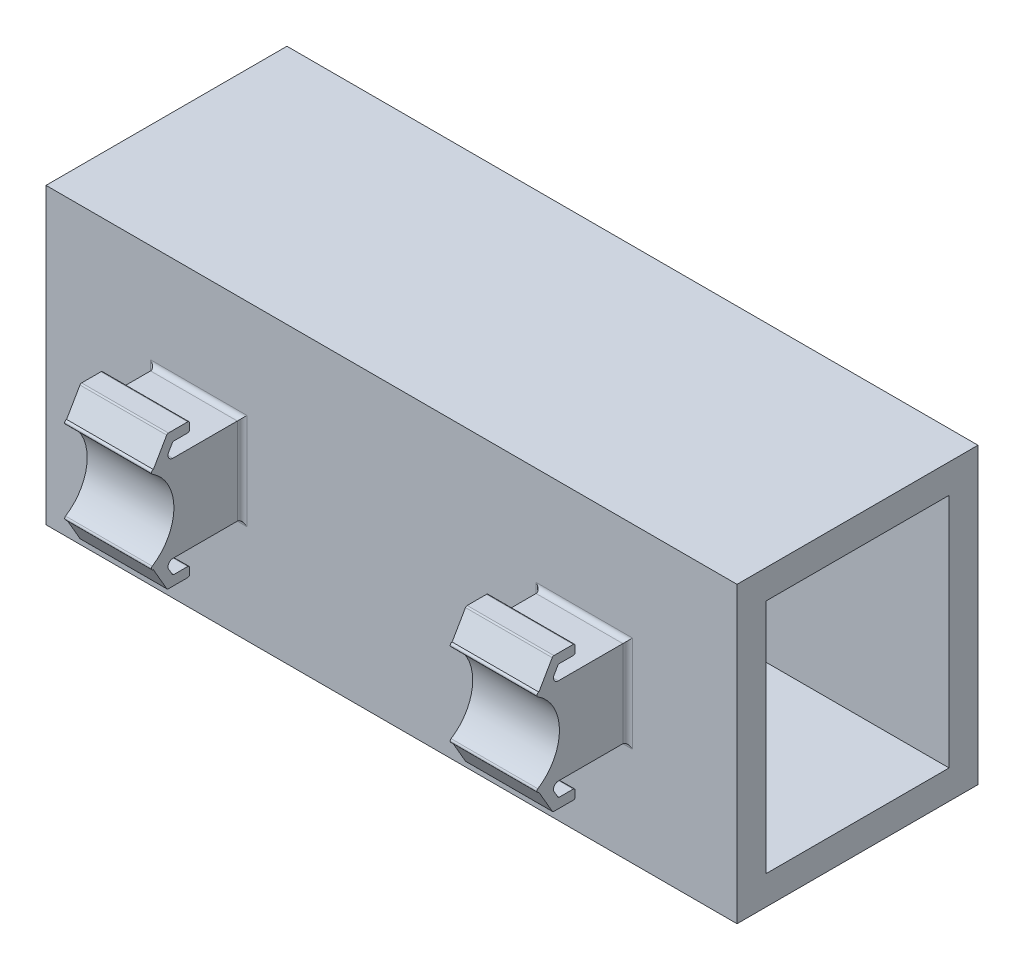
from build123d import *

# Parameters (mm, degrees)
SKETCH_1_W          = 71.7
SKETCH_1_H          = 30.5
EXTRUDE_1_DEPTH     = 25
SHELL_1_T           = -3
CUT_EXTRUDE_1_REACH = 48.29
SKETCH_2_W          = 30
SKETCH_2_H          = 10
SKETCH_3_W          = 9
SKETCH_3_H          = 9
EXTRUDE_2_DEPTH     = 10
SKETCH_4_R          = 4.924428901
CUT_EXTRUDE_2_DEPTH = 72.41207881
FILLET_1_R          = 0.2
EXTRUDE_3_DEPTH     = 9
FILLET_2_R          = 0.2
FILLET_3_R          = 0.5
MIRROR_START        = 15.5
MIRROR_2_DEPTH      = 9
FILLET_5_R          = 0.5
FILLET_6_R          = 0.5


# Read off the part's stored shape, not the designer's step: 镜向2
with BuildPart() as part:
    # 草图1 → 凸台-拉伸1 (new body)
    with BuildSketch(Plane.XY):
        Rectangle(SKETCH_1_W, SKETCH_1_H)
    extrude(amount=EXTRUDE_1_DEPTH)

    # 抽壳1
    shell_1_openings = [part.faces().sort_by_distance(p)[0] for p in [
        (35.85, 0, 12.5),
    ]]
    offset(amount=SHELL_1_T, openings=shell_1_openings, kind=Kind.INTERSECTION)

    # 草图2 → 切除-拉伸1 (cut, up to next)
    with BuildSketch(Plane(origin=(0, 0, 0), x_dir=(-1, 0, 0), z_dir=(0, 0, -1)), mode=Mode.PRIVATE) as cut_extrude_1_sk1:
        with Locations((17.35, -6.95)):
            Rectangle(SKETCH_2_W, SKETCH_2_H)
    cut_extrude_1_tool1 = extrude(cut_extrude_1_sk1.sketch, amount=-CUT_EXTRUDE_1_REACH, mode=Mode.PRIVATE) & part.part
    add(cut_extrude_1_tool1.solids().sort_by_distance((-17.35, -6.95, 0))[0], mode=Mode.SUBTRACT)

    # 草图3 → 凸台-拉伸2 (add)
    with BuildSketch(Plane.XY.offset(25)):
        with Locations((-20, 0)):
            Rectangle(SKETCH_3_W, SKETCH_3_H)
        with Locations((20, 0)):
            Rectangle(SKETCH_3_W, SKETCH_3_H)
    extrude(amount=EXTRUDE_2_DEPTH)

    # 草图4 → 切除-拉伸2 (cut, through all)
    with BuildSketch(Plane.ZY.offset(24.5)):
        with Locations((37, 0)):
            Circle(SKETCH_4_R)
    extrude(amount=-CUT_EXTRUDE_2_DEPTH, mode=Mode.SUBTRACT)

    # 圆角1
    fillet_1_edges = [part.edges().sort_by_distance(p)[0] for p in [
        (-20, 4.5, 35),
        (-20, -4.5, 35),
        (20, 4.5, 35),
        (20, -4.5, 35),
    ]]
    fillet(fillet_1_edges, radius=FILLET_1_R)

    # 草图5 → 凸台-拉伸3 (add)
    with BuildSketch(Plane.ZY.offset(24.5)):
        Polygon((34.212569003, 4.5), (32.769193331, 7), (30.446869021, 7), (30.446869021, 6), (32.191843061, 6), (33.057868465, 4.5), align=None)
        Polygon((32.769193331, -7), (30.446869021, -7), (30.446869021, -6), (32.191843061, -6), (33.057868465, -4.5), (34.212569003, -4.5), align=None)
    extrude(amount=-EXTRUDE_3_DEPTH)

    # 圆角2
    fillet_2_edges = [part.edges().sort_by_distance(p)[0] for p in [
        (-20, 6, 32.191843061),
        (-20, 6, 30.446869021),
        (-20, 7, 30.446869021),
        (-20, 7, 32.769193331),
        (-20, -7, 32.769193331),
        (-20, -7, 30.446869021),
        (-20, -6, 30.446869021),
        (-20, -6, 32.191843061),
    ]]
    fillet(fillet_2_edges, radius=FILLET_2_R)

    # 圆角3
    fillet_3_edges = [part.edges().sort_by_distance(p)[0] for p in [
        (-20, 4.5, 33.057868465),
        (-20, -4.5, 33.057868465),
    ]]
    fillet(fillet_3_edges, radius=FILLET_3_R)

    # 镜向2 outline → 镜向2 (add)
    with BuildSketch(Plane.YZ.offset(MIRROR_START)):
        with BuildLine():
            Line((5.25, 32.624855763), (5.9, 32.249578088))
            ThreePointArc((5.9, 32.249578088), (5.973205081, 32.176373007), (6, 32.076373007))
            Line((6, 32.076373007), (6, 30.646869021))
            ThreePointArc((6, 30.646869021), (6.058578644, 30.505447665), (6.2, 30.446869021))
            Line((6.2, 30.446869021), (6.8, 30.446869021))
            ThreePointArc((6.8, 30.446869021), (6.941421356, 30.505447665), (7, 30.646869021))
            Line((7, 30.646869021), (7, 32.653723277))
            ThreePointArc((7, 32.653723277), (6.973205081, 32.753723277), (6.9, 32.826928357))
            Line((6.9, 32.826928357), (4.5, 34.212569003))
            Line((4.5, 34.212569003), (4.5, 32.191843061))
            ThreePointArc((4.5, 32.191843061), (4.75, 32.624855763), (5.25, 32.624855763))
        make_face()
        with BuildLine():
            Line((-6.8, 30.446869021), (-6.2, 30.446869021))
            ThreePointArc((-6.2, 30.446869021), (-6.058578644, 30.505447665), (-6, 30.646869021))
            Line((-6, 30.646869021), (-6, 32.076373007))
            ThreePointArc((-6, 32.076373007), (-5.973205081, 32.176373007), (-5.9, 32.249578088))
            Line((-5.9, 32.249578088), (-5.25, 32.624855763))
            ThreePointArc((-5.25, 32.624855763), (-4.75, 32.624855763), (-4.5, 32.191843061))
            Line((-4.5, 32.191843061), (-4.5, 34.212569003))
            Line((-4.5, 34.212569003), (-6.9, 32.826928357))
            ThreePointArc((-6.9, 32.826928357), (-6.973205081, 32.753723277), (-7, 32.653723277))
            Line((-7, 32.653723277), (-7, 30.646869021))
            ThreePointArc((-7, 30.646869021), (-6.941421356, 30.505447665), (-6.8, 30.446869021))
        make_face()
    extrude(amount=MIRROR_2_DEPTH)

    # 圆角5
    fillet_5_edges = [part.edges().sort_by_distance(p)[0] for p in [
        (-15.5, 0, 25),
        (-20, 4.5, 25),
        (-24.5, 0, 25),
        (-20, -4.5, 25),
    ]]
    fillet(fillet_5_edges, radius=FILLET_5_R)

    # 圆角6
    fillet_6_edges = [part.edges().sort_by_distance(p)[0] for p in [
        (24.5, 0, 25),
        (20, 4.5, 25),
        (15.5, 0, 25),
        (20, -4.5, 25),
    ]]
    fillet(fillet_6_edges, radius=FILLET_6_R)


solid = part.part
